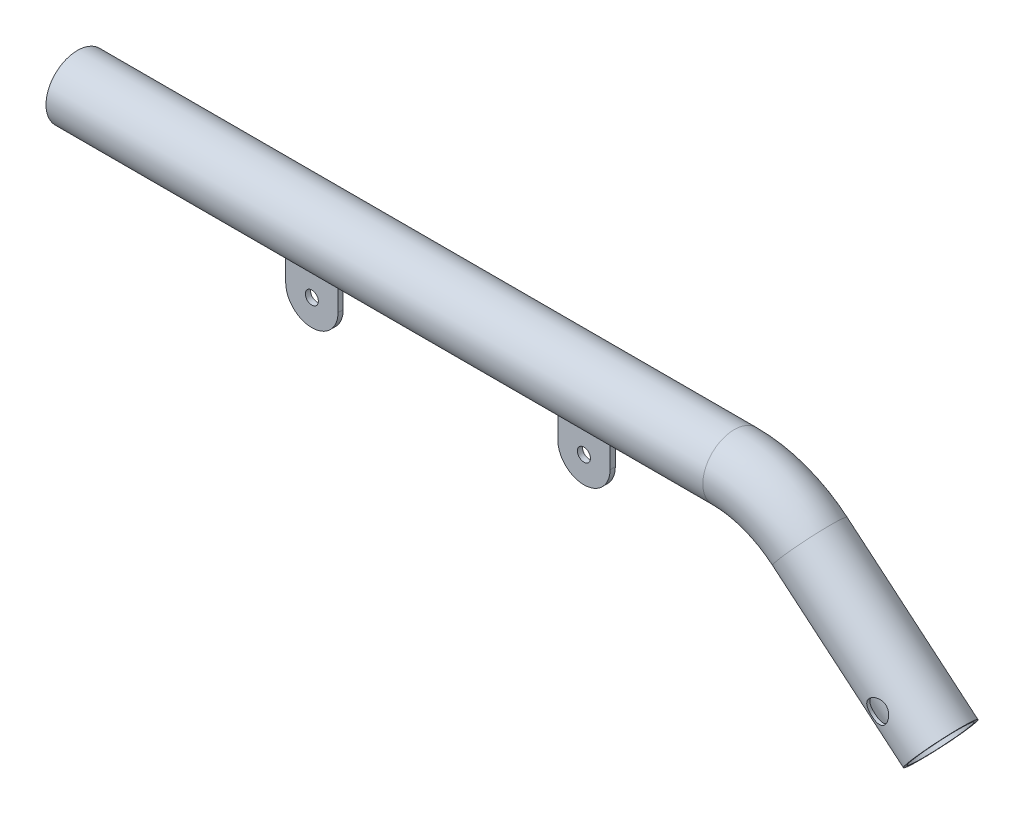
from build123d import *

# Parameters (mm, degrees)
SKETCH2_R                = 12
SKETCH2_R_2              = 10.8
CUT_EXTRUDE1_DEPTH       = 20
CUT_EXTRUDE1_DEPTH_BACK  = 20
SKETCH3_R                = 4.14257131
BOSS_EXTRUDE1_DEPTH      = 1
BOSS_EXTRUDE1_DEPTH_BACK = 1
SKETCH4_R                = 2.5


with BuildPart() as part:
    # Sweep1: sweep along a path in Sketch1
    with BuildLine(Plane.XY) as sweep1_path:
        Line((-209.367896725, 0), (41.706660839, 0))
        ThreePointArc((41.706660839, 0), (57.097567289, -2.713832065), (70.632103275, -10.52800006))
        Line((70.632103275, -10.52800006), (120.632103275, -52.482981619))
    # Sketch2 → Sweep1 (sweep)
    with BuildSketch(Plane(origin=(-209.367896725, 0, 0), x_dir=(0, 0, -1), z_dir=(1, 0, 0))):
        Circle(SKETCH2_R)
        Circle(SKETCH2_R_2, mode=Mode.SUBTRACT)
    sweep(path=sweep1_path.line)

    # Sketch3 → Cut-Extrude1 (cut, two sides: drawn at the far end of the back side and taken through both)
    with BuildSketch(Plane.XY.offset(-CUT_EXTRUDE1_DEPTH_BACK)):
        with Locations((108.258660408, -42.100430272)):
            Circle(SKETCH3_R)
    extrude(amount=CUT_EXTRUDE1_DEPTH + CUT_EXTRUDE1_DEPTH_BACK, mode=Mode.SUBTRACT)

    # Sketch4 → Boss-Extrude1 (add, two sides: drawn at the far end of the back side and taken through both)
    # profile 1 of 2: a face of its own
    with BuildSketch(Plane.XY.offset(-BOSS_EXTRUDE1_DEPTH_BACK)):
        with BuildLine():
            Line((-128.741339592, 0), (-128.741339592, -24))
            ThreePointArc((-128.741339592, -24), (-118.741339592, -34), (-108.741339592, -24))
            Line((-108.741339592, -24), (-108.741339592, 0))
            Line((-108.741339592, 0), (-128.741339592, 0))
        make_face()
        with Locations((-118.741339592, -24)):
            Circle(SKETCH4_R, mode=Mode.SUBTRACT)
    # profile 2 of 2: a face of its own
    with BuildSketch(Plane.XY.offset(-BOSS_EXTRUDE1_DEPTH_BACK)):
        with BuildLine():
            Line((-24.741339592, 0), (-4.741339592, 0))
            Line((-4.741339592, 0), (-4.741339592, -24))
            ThreePointArc((-4.741339592, -24), (-14.741339592, -34), (-24.741339592, -24))
            Line((-24.741339592, -24), (-24.741339592, 0))
        make_face()
        with Locations((-14.741339592, -24)):
            Circle(SKETCH4_R, mode=Mode.SUBTRACT)
    extrude(amount=BOSS_EXTRUDE1_DEPTH + BOSS_EXTRUDE1_DEPTH_BACK)


solid = part.part
